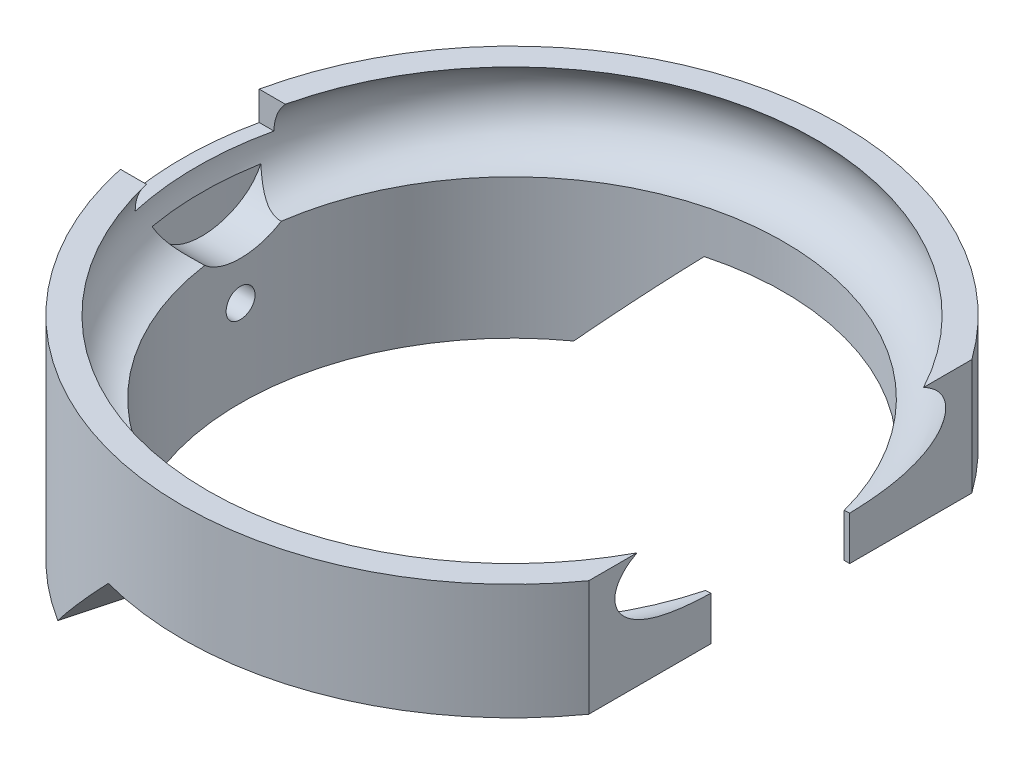
from build123d import *
from build123d.topology import SkipClean

# Parameters (mm, degrees)
CROQUIS1_R                 = 17.1
CROQUIS1_R_2               = 14.1
SALIENTE_EXTRUIR1_DEPTH    = 4.5
CORTAR_EXTRUIR1_REACH      = 27.803
CROQUIS2_W                 = 15.420651877
CROQUIS2_H                 = 7.2
CROQUIS54_W                = 3
CROQUIS54_H                = 19
REVOLUCI_N1_ANGLE          = 150
CORTAR_BARRER2_PROFILE_R   = 2.25
CHAFL_N3_SIZE              = 5
CORTAR_EXTRUIR2_REACH      = 27.982
CORTAR_EXTRUIR2_END_RADIUS = 16.1
CROQUIS61_R                = 3
CORTAR_EXTRUIR3_DEPTH      = 26.982109266
CORTAR_EXTRUIR3_DEPTH_BACK = 26.982109266
CORTAR_EXTRUIR4_REACH      = 41.067
CORTAR_EXTRUIR4_END_RADIUS = 14.1
CROQUIS63_R                = 0.75
CROQUIS64_R                = 1.25
CORTAR_EXTRUIR5_DEPTH      = 0.5
CORTAR_EXTRUIR6_START      = -11
CROQUIS65_W                = 2.8
CROQUIS65_H                = 19.872981168
CORTAR_EXTRUIR6_DEPTH      = 11


with BuildPart() as part:
    # Croquis1 → Saliente-Extruir1 (new, symmetric)
    with BuildSketch(Plane(origin=(0, 0, 0), x_dir=(1, 0, 0), z_dir=(0, 1, 0))):
        with Locations(Location((0, 0, 0), (0, 0, 270))):
            Circle(CROQUIS1_R)
        with Locations(Location((0, 0, 0), (0, 0, 270))):
            Circle(CROQUIS1_R_2, mode=Mode.SUBTRACT)
    extrude(amount=SALIENTE_EXTRUIR1_DEPTH, both=True)

    # Croquis2 → Cortar-Extruir1 (cut, up to next)
    with BuildSketch(Plane(origin=(0, 4.5, 0), x_dir=(1, 0, 0), z_dir=(0, 1, 0)), mode=Mode.PRIVATE) as cortar_extruir1_sk1:
        with Locations((15.870282115, 0)):
            Rectangle(CROQUIS2_W, CROQUIS2_H)
    cortar_extruir1_tool1 = extrude(cortar_extruir1_sk1.sketch, amount=-CORTAR_EXTRUIR1_REACH, mode=Mode.PRIVATE) & part.part
    add(cortar_extruir1_tool1.solids().sort_by_distance((15.870282, 4.5, 0))[0], mode=Mode.SUBTRACT)

    # Croquis54 → Revolución1 (revolve, symmetric)
    with SkipClean():  # the faces are left unmerged after this step: merging them gives an invalid solid
        with BuildSketch(Plane.XY) as revoluci_n1_sk:
            with Locations((-15.6, 0)):
                Rectangle(CROQUIS54_W, CROQUIS54_H)
        revolve(axis=Axis((0, -13.582020258, 0), (0, 1, 0)), revolution_arc=REVOLUCI_N1_ANGLE / 2)
        revolve(revoluci_n1_sk.sketch, axis=Axis((0, -13.582020258, 0), (0, -1, 0)), revolution_arc=REVOLUCI_N1_ANGLE / 2)
    add(part.part.scale(1), mode=Mode.REPLACE)  # the faces are merged on a copy

    # Cortar-Barrer2: sweep along a path in Croquis12
    with BuildLine(Plane(origin=(0, 0, 0), x_dir=(1, 0, 0), z_dir=(0, 1, 0))) as cortar_barrer2_path:
        CenterArc((0, 0), 14.1, 0, 360)
    # Cortar-Barrer2 profile (on start of the path) → Cortar-Barrer2 (sweep, cut)
    with BuildSketch(Plane(origin=(14.1, 0, 0), x_dir=(-1, 0, 0), z_dir=(0, 0, -1))):
        Circle(CORTAR_BARRER2_PROFILE_R)
    sweep(path=cortar_barrer2_path.line, mode=Mode.SUBTRACT)

    # Chaflán3
    chafl_n3_edges = [part.edges().sort_by_distance(p)[0] for p in [
        (-4.037577104, -9.5, -15.06844289),
        (-4.037577104, 9.5, -15.06844289),
        (-4.037577104, -9.5, 15.06844289),
        (-4.037577104, 9.5, 15.06844289),
    ]]
    chamfer(chafl_n3_edges, length=CHAFL_N3_SIZE - 0.0001)  # a hair under: the kernel refuses the full size

    # Cortar-Extruir2: up to this cylinder (the profile starts inside it)
    cortar_extruir2_end = Plane(origin=(0, 0, 0), z_dir=(0, -1, 0)) * Cylinder(CORTAR_EXTRUIR2_END_RADIUS, 89.164, mode=Mode.PRIVATE)
    # Croquis61 → Cortar-Extruir2 (cut, up to the surface)
    with BuildSketch(Plane(origin=(0, 0, 0), x_dir=(0, 0, -1), z_dir=(1, 0, 0)), mode=Mode.PRIVATE) as cortar_extruir2_sk1:
        Circle(CROQUIS61_R)
    cortar_extruir2_tool1 = extrude(cortar_extruir2_sk1.sketch, amount=-CORTAR_EXTRUIR2_REACH, mode=Mode.PRIVATE) & cortar_extruir2_end
    add(cortar_extruir2_tool1.solids().sort_by_distance((0, 0, 0))[0], mode=Mode.SUBTRACT)

    # Croquis62 → Cortar-Extruir3 (cut, two sides: drawn at the far end of the back side and taken through both)
    with BuildSketch(Plane(origin=(0, 0, 0), x_dir=(0, 0, -1), z_dir=(1, 0, 0)).offset(-CORTAR_EXTRUIR3_DEPTH_BACK)):
        Polygon((-3.6, 1.5), (-3.6, 0), (3.6, 0), (3.6, 1.5), (19.353781031, 1.5), (19.353781031, 12.340609049), (-20.692074401, 12.340609049), (-20.692074401, 1.5), align=None)
    extrude(amount=CORTAR_EXTRUIR3_DEPTH + CORTAR_EXTRUIR3_DEPTH_BACK, mode=Mode.SUBTRACT)

    # Cortar-Extruir4: up to this cylinder (the profile starts outside it)
    with SkipClean():  # the faces are left unmerged after this step: merging them gives an invalid solid
        cortar_extruir4_end = Plane(origin=(0, -5, 0), z_dir=(0, -1, 0)) * Cylinder(CORTAR_EXTRUIR4_END_RADIUS, 111.334, mode=Mode.PRIVATE)
        # Croquis63 → Cortar-Extruir4 (cut, up to the surface)
        with BuildSketch(Plane(origin=(-17.1, 0, 0), x_dir=(0, -1, 0), z_dir=(-1, 0, 0)), mode=Mode.PRIVATE) as cortar_extruir4_sk1:
            with Locations(Location((5, 0, 0), (0, 0, 90))):
                Circle(CROQUIS63_R)
        cortar_extruir4_tool1 = extrude(cortar_extruir4_sk1.sketch, amount=-CORTAR_EXTRUIR4_REACH, mode=Mode.PRIVATE) - cortar_extruir4_end
        add(cortar_extruir4_tool1.solids().sort_by_distance((-17.1, -5, 0))[0], mode=Mode.SUBTRACT)

    # Croquis64 → Cortar-Extruir5 (cut)
    with SkipClean():  # the faces are left unmerged after this step: merging them gives an invalid solid
        with BuildSketch(Plane(origin=(-17.1, 0, 0), x_dir=(0, -1, 0), z_dir=(-1, 0, 0))):
            with Locations(Location((5, 0, 0), (0, 0, 90))):
                Circle(CROQUIS64_R)
        extrude(amount=-CORTAR_EXTRUIR5_DEPTH, mode=Mode.SUBTRACT)

    # Croquis65 → Cortar-Extruir6 (cut)
    with SkipClean():  # the faces are left unmerged after this step: merging them gives an invalid solid
        with BuildSketch(Plane(origin=(0, 1.5, 0), x_dir=(1, 0, 0), z_dir=(0, 1, 0)).offset(CORTAR_EXTRUIR6_START)):
            with Locations((15.316758059, 0)):
                Rectangle(CROQUIS65_W, CROQUIS65_H)
        extrude(amount=CORTAR_EXTRUIR6_DEPTH, mode=Mode.SUBTRACT)


solid = part.part
